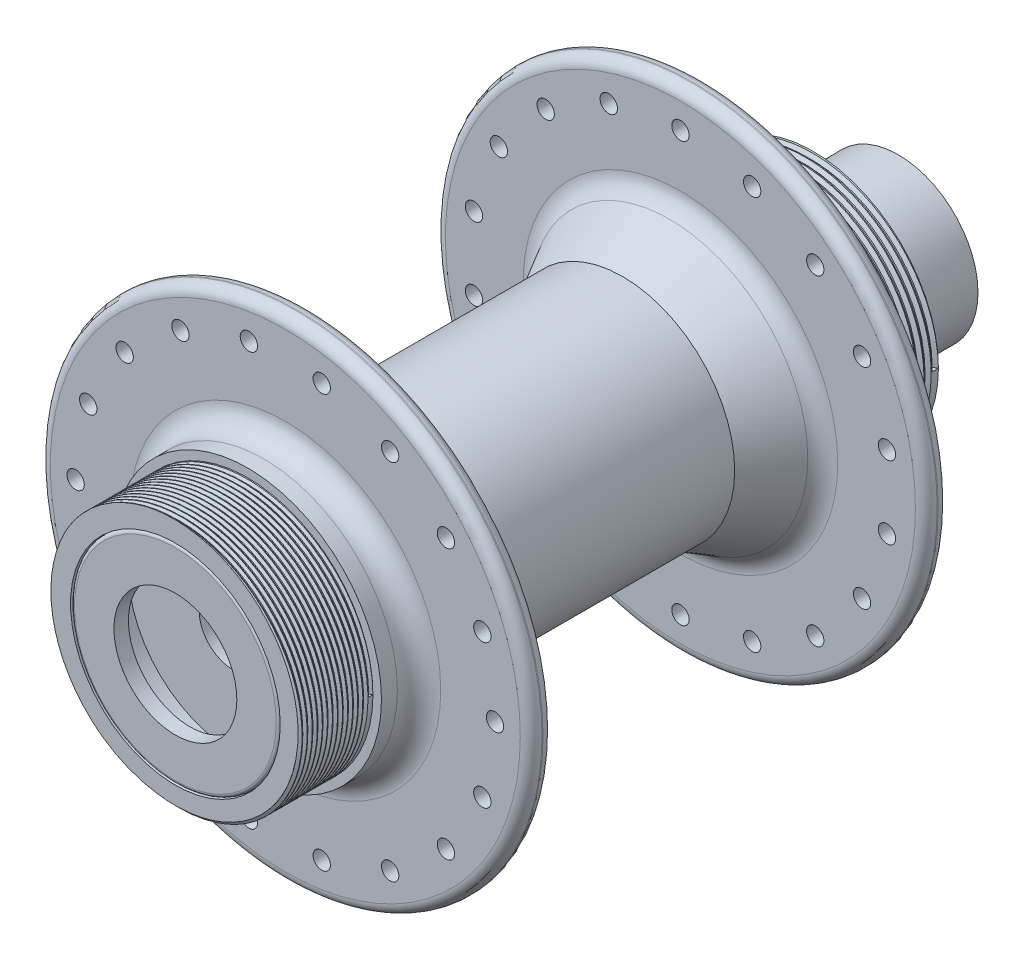
from build123d import *

# Parameters (mm, degrees)
THREAD1_PITCH       = 0.7
SKETCH27_R          = 14.5
CUT_EXTRUDE1_DEPTH  = 8
SKETCH32_R          = 14.45
SKETCH32_R_2        = 8.5
BOSS_EXTRUDE1_DEPTH = 2
FILLET1_R           = 0.5
SKETCH33_R          = 8.5
CUT_EXTRUDE2_DEPTH  = 6
SKETCH34_R          = 1.2
CUT_EXTRUDE3_DEPTH  = 10
SKETCH35_R          = 1.2
CUT_EXTRUDE4_DEPTH  = 10
THREAD2_PITCH       = 1


with BuildPart() as part:
    # Sketch1 → Revolve1 (revolve)
    with BuildSketch(Plane(origin=(0, 0, 0), x_dir=(0, 0, -1), z_dir=(1, 0, 0)), mode=Mode.PRIVATE) as revolve1_sk:
        with BuildLine():
            Line((-62.542386832, 21.5), (-62.542386832, 32.5))
            ThreePointArc((-62.542386832, 32.5), (-62.103047004, 33.560660172), (-61.042386832, 34))
            Line((-61.042386832, 34), (-60.892386832, 34))
            ThreePointArc((-60.892386832, 34), (-59.83172666, 33.560660172), (-59.392386832, 32.5))
            Line((-59.392386832, 32.5), (-59.392386832, 21.754542453))
            ThreePointArc((-59.392386832, 21.754542453), (-58.982015295, 20.240004761), (-57.863170551, 19.139815842))
            Line((-57.863170551, 19.139815842), (-51.392386832, 15.5))
            Line((-51.392386832, 15.5), (-15.892386832, 15.5))
            Line((-15.892386832, 15.5), (-9.421603113, 19.139815842))
            ThreePointArc((-9.421603113, 19.139815842), (-8.302758369, 20.240004761), (-7.892386832, 21.754542453))
            Line((-7.892386832, 21.754542453), (-7.892386832, 32.5))
            ThreePointArc((-7.892386832, 32.5), (-7.453047004, 33.560660172), (-6.392386832, 34))
            Line((-6.392386832, 34), (-6.242386832, 34))
            ThreePointArc((-6.242386832, 34), (-5.18172666, 33.560660172), (-4.742386832, 32.5))
            Line((-4.742386832, 32.5), (-4.742386832, 21.5))
            ThreePointArc((-4.742386832, 21.5), (-3.863707175, 19.378679656), (-1.742386832, 18.5))
            Line((-1.742386832, 18.5), (0.457613168, 18.5))
            Line((0.457613168, 18.5), (0.457613168, 17.325))
            Line((0.457613168, 17.325), (10.457613168, 17.325))
            Line((10.457613168, 17.325), (10.457613168, 11.0125))
            Line((10.457613168, 11.0125), (22.257613168, 11))
            Line((22.257613168, 11), (22.257613168, 4.7))
            Line((22.257613168, 4.7), (-77.742386832, 4.7))
            Line((-77.742386832, 4.7), (-77.742386832, 17.325))
            Line((-77.742386832, 17.325), (-67.742386832, 17.325))
            Line((-67.742386832, 17.325), (-67.742386832, 18.5))
            Line((-67.742386832, 18.5), (-65.542386832, 18.5))
            ThreePointArc((-65.542386832, 18.5), (-63.421066488, 19.378679656), (-62.542386832, 21.5))
        make_face()
    revolve(revolve1_sk.sketch.rotate(Axis((0, 0, 77.742386832), (0, 0, -1)), 90), axis=Axis((0, 0, 77.742386832), (0, 0, -1)))

    # Thread1: the profile of Thread Profile1 profile screwed along a right-hand helix of 14.285714 turns, 6 arcs to a turn; built about Z, then put on its axis
    thread1_z = Axis((0, 0, 0), (0, 0, 1))
    thread1_corners = [(17.3253, 0, -0.000173205), (17.3253, 0, 0.612673203), (16.946113888, 0, 0.393749999), (16.946113888, 0, 0.218749999)]
    with BuildLine(mode=Mode.PRIVATE) as thread1_profile:
        Line(thread1_corners[0], thread1_corners[1])
        Line(thread1_corners[1], thread1_corners[2])
        Line(thread1_corners[2], thread1_corners[3])
        Line(thread1_corners[3], thread1_corners[0])
    thread1_cap = Face(thread1_profile.wire())
    thread1_turn_angles = [0, 30, 60, 90, 120, 150, 180, 210, 240, 270, 300, 330, 360]
    thread1_turn_weights = [1, 0.8660254037844387, 1, 0.8660254037844387, 1, 0.8660254037844387, 1, 0.8660254037844387, 1, 0.8660254037844387, 1, 0.8660254037844387, 1]
    thread1_turn_rails = [Edge.make_bspline([Vector(p[0], p[1], 0).rotate(thread1_z, thread1_turn_angles[k]) / thread1_turn_weights[k] + Vector(0, 0, p[2] + THREAD1_PITCH * thread1_turn_angles[k] / 360) for k in range(13)], [0, 0, 0, 1, 1, 2, 2, 3, 3, 4, 4, 5, 5, 6, 6, 6], 2, thread1_turn_weights) for p in thread1_corners]
    thread1_turn_sides = [Face.make_surface_from_curves(thread1_turn_rails[p[0]], thread1_turn_rails[p[1]]) for p in [(0, 1), (1, 2), (2, 3), (3, 0)]]
    thread1_last_angles = [5040, 5070, 5100, 5121.428571429, 5142.857142857]
    thread1_last_weights = [1, 0.8660254037844387, 1, 0.9308737486442121, 1]
    thread1_last_rails = [Edge.make_bspline([Vector(p[0], p[1], 0).rotate(thread1_z, thread1_last_angles[k]) / thread1_last_weights[k] + Vector(0, 0, p[2] + THREAD1_PITCH * thread1_last_angles[k] / 360) for k in range(5)], [0, 0, 0, 1, 1, 2, 2, 2], 2, thread1_last_weights) for p in thread1_corners]
    thread1_last_sides = [Face.make_surface_from_curves(thread1_last_rails[p[0]], thread1_last_rails[p[1]]) for p in [(0, 1), (1, 2), (2, 3), (3, 0)]]
    thread1 = Plane(origin=(0, 0, 67.742386832), x_dir=(1, 0, 0), z_dir=(0, 0, 1)) * Solid(Shell([*[p.moved(Location((0, 0, THREAD1_PITCH * i))) for i in range(14) for p in thread1_turn_sides], *thread1_last_sides, thread1_cap, thread1_cap.rotate(thread1_z, 5142.857142857).moved(Location((0, 0, THREAD1_PITCH * 5142.857142857 / 360)))]))
    add(thread1, mode=Mode.SUBTRACT)

    # Sketch27 → Cut-Extrude1 (cut)
    with BuildSketch(Plane.XY.offset(77.742386832)):
        Circle(SKETCH27_R)
    extrude(amount=-CUT_EXTRUDE1_DEPTH, mode=Mode.SUBTRACT)

    # Sketch33 → Cut-Extrude2 (cut)
    with BuildSketch(Plane(origin=(0, 0, -22.257613168), x_dir=(-1, 0, 0), z_dir=(0, 0, -1))):
        with Locations(Location((0, 0, 0), (0, 0, 180))):
            Circle(SKETCH33_R)
    extrude(amount=-CUT_EXTRUDE2_DEPTH, mode=Mode.SUBTRACT)

    # Sketch34 → Cut-Extrude3 (cut)
    with BuildSketch(Plane(origin=(0, 0, 4.742386832), x_dir=(-1, 0, 0), z_dir=(0, 0, -1))):
        with Locations((0, 29)):
            Circle(SKETCH34_R)
        with Locations((9.918523849, 27.251428023)):
            Circle(SKETCH34_R)
        with Locations((18.640840681, 22.215972891)):
            Circle(SKETCH34_R)
        with Locations((25.114910358, 14.500984808)):
            Circle(SKETCH34_R)
        with Locations((28.55986453, 5.037005198)):
            Circle(SKETCH34_R)
        with Locations((28.560190882, -5.034470324)):
            Circle(SKETCH34_R)
        with Locations((25.115850051, -14.498673172)):
            Circle(SKETCH34_R)
        with Locations((18.642280374, -22.214080805)):
            Circle(SKETCH34_R)
        with Locations((9.920289894, -27.250101195)):
            Circle(SKETCH34_R)
        with Locations((0.001879385, -28.99931596)):
            Circle(SKETCH34_R)
        with Locations((-9.916644464, -27.250743983)):
            Circle(SKETCH34_R)
        with Locations((-18.638961296, -22.21528885)):
            Circle(SKETCH34_R)
        with Locations((-25.113030973, -14.500300767)):
            Circle(SKETCH34_R)
        with Locations((-28.557985145, -5.036321158)):
            Circle(SKETCH34_R)
        with Locations((-28.558311497, 5.035154365)):
            Circle(SKETCH34_R)
        with Locations((-25.113970665, 14.499357212)):
            Circle(SKETCH34_R)
        with Locations((-18.640400988, 22.214764845)):
            Circle(SKETCH34_R)
        with Locations((-9.918410508, 27.250785235)):
            Circle(SKETCH34_R)
    extrude(amount=-CUT_EXTRUDE3_DEPTH, mode=Mode.SUBTRACT)

    # Sketch35 → Cut-Extrude4 (cut)
    with BuildSketch(Plane.XY.offset(62.542386832)):
        with Locations((5.035797152, 28.559424837)):
            Circle(SKETCH35_R)
        with Locations((14.499939693, 25.11507873)):
            Circle(SKETCH35_R)
        with Locations((22.21528885, 18.641524721)):
            Circle(SKETCH35_R)
        with Locations((27.251259651, 9.919568964)):
            Circle(SKETCH35_R)
        with Locations((29.000439693, 0.001208046)):
            Circle(SKETCH35_R)
        with Locations((27.251852047, -9.917257329)):
            Circle(SKETCH35_R)
        with Locations((22.216402191, -18.639513853)):
            Circle(SKETCH35_R)
        with Locations((14.501439693, -25.113528664)):
            Circle(SKETCH35_R)
        with Locations((5.037502889, -28.55844003)):
            Circle(SKETCH35_R)
        with Locations((-5.033917767, -28.558740797)):
            Circle(SKETCH35_R)
        with Locations((-14.498060307, -25.11439469)):
            Circle(SKETCH35_R)
        with Locations((-22.213409465, -18.640840681)):
            Circle(SKETCH35_R)
        with Locations((-27.249380266, -9.918884924)):
            Circle(SKETCH35_R)
        with Locations((-28.998560307, -0.000524005)):
            Circle(SKETCH35_R)
        with Locations((-27.249972662, 9.917941369)):
            Circle(SKETCH35_R)
        with Locations((-22.214522806, 18.640197893)):
            Circle(SKETCH35_R)
        with Locations((-14.499560307, 25.114212704)):
            Circle(SKETCH35_R)
        with Locations((-5.035623504, 28.55912407)):
            Circle(SKETCH35_R)
    extrude(amount=-CUT_EXTRUDE4_DEPTH, mode=Mode.SUBTRACT)

    # Thread2: the profile of Thread Profile2 profile screwed along a right-hand helix of 10 turns, 8 arcs to a turn; built about Z, then put on its axis
    thread2_z = Axis((0, 0, 0), (0, 0, 1))
    thread2_corners = [(17.3253, 0, -0.000173205), (17.3253, 0, 0.875173202), (16.783734125, 0, 0.562499999), (16.783734125, 0, 0.312499999)]
    with BuildLine(mode=Mode.PRIVATE) as thread2_profile:
        Line(thread2_corners[0], thread2_corners[1])
        Line(thread2_corners[1], thread2_corners[2])
        Line(thread2_corners[2], thread2_corners[3])
        Line(thread2_corners[3], thread2_corners[0])
    thread2_cap = Face(thread2_profile.wire())
    thread2_turn_angles = [0, 22.5, 45, 67.5, 90, 112.5, 135, 157.5, 180, 202.5, 225, 247.5, 270, 292.5, 315, 337.5, 360]
    thread2_turn_weights = [1, 0.9238795325112867, 1, 0.9238795325112867, 1, 0.9238795325112867, 1, 0.9238795325112867, 1, 0.9238795325112867, 1, 0.9238795325112867, 1, 0.9238795325112867, 1, 0.9238795325112867, 1]
    thread2_turn_rails = [Edge.make_bspline([Vector(p[0], p[1], 0).rotate(thread2_z, thread2_turn_angles[k]) / thread2_turn_weights[k] + Vector(0, 0, p[2] + THREAD2_PITCH * thread2_turn_angles[k] / 360) for k in range(17)], [0, 0, 0, 1, 1, 2, 2, 3, 3, 4, 4, 5, 5, 6, 6, 7, 7, 8, 8, 8], 2, thread2_turn_weights) for p in thread2_corners]
    thread2_turn_sides = [Face.make_surface_from_curves(thread2_turn_rails[p[0]], thread2_turn_rails[p[1]]) for p in [(0, 1), (1, 2), (2, 3), (3, 0)]]
    thread2 = Plane(origin=(0, 0, -10.457613168), x_dir=(1, 0, 0), z_dir=(0, 0, 1)) * Solid(Shell([*[p.moved(Location((0, 0, THREAD2_PITCH * i))) for i in range(10) for p in thread2_turn_sides], thread2_cap, thread2_cap.rotate(thread2_z, 3600).moved(Location((0, 0, THREAD2_PITCH * 3600 / 360)))]))
    add(thread2, mode=Mode.SUBTRACT)


with BuildPart() as body_2:
    # Sketch32 → Boss-Extrude1 (new body)
    with BuildSketch(Plane.XY.offset(77.742386832)):
        Circle(SKETCH32_R)
        Circle(SKETCH32_R_2, mode=Mode.SUBTRACT)
    extrude(amount=-BOSS_EXTRUDE1_DEPTH)

    # Fillet1
    fillet1_edges = [body_2.edges().sort_by_distance(p)[0] for p in [
        (-14.45, 0, 77.742386832),
    ]]
    fillet(fillet1_edges, radius=FILLET1_R)


solid = Compound([part.part, body_2.part])
